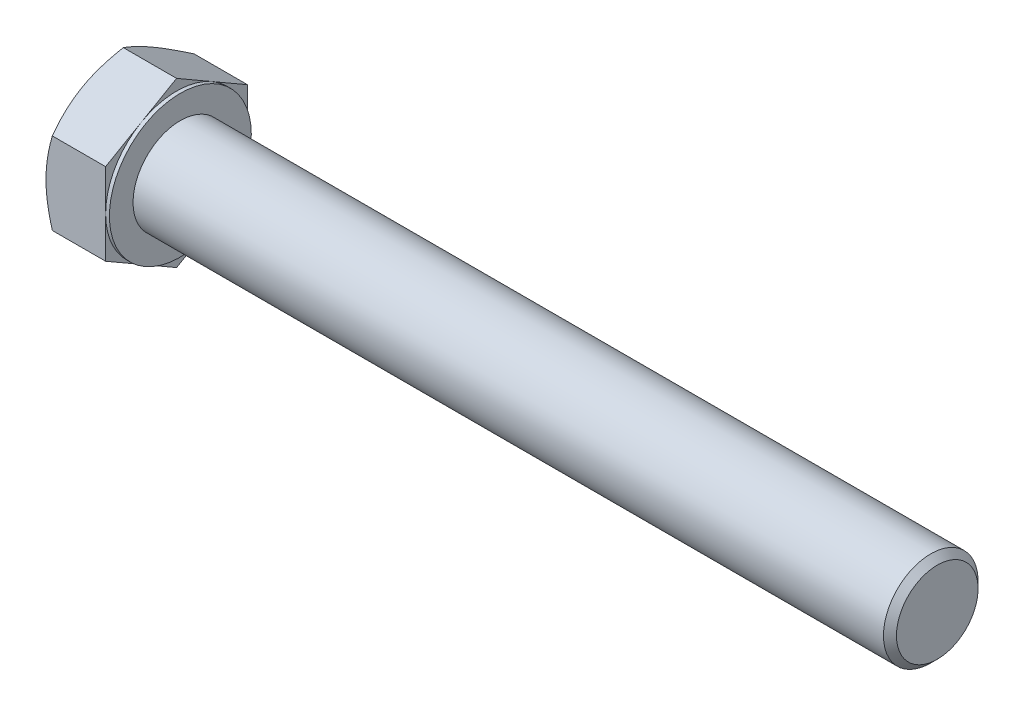
from build123d import *

# Parameters (mm, degrees)
BASEHEAD_DEPTH = 13.4
SKETCH4_W      = 0.8
SKETCH4_H      = 12.320508076


# Read off the part's stored shape, not the designer's step: HeadChamfer
with BuildPart() as part:
    # Sketch1 → BaseHead (new body)
    with BuildSketch(Plane(origin=(0, 0, 0), x_dir=(0, 0, -1), z_dir=(1, 0, 0))):
        Polygon((15, 8.660254038), (15, -8.660254038), (0, -17.320508076), (-15, -8.660254038), (-15, 8.660254038), (0, 17.320508076), align=None)
    extrude(amount=BASEHEAD_DEPTH)

    # HeadChamfer outline → HeadChamfer (revolve, cut)
    with BuildSketch(Plane.YX):
        Polygon((17.320508077, 1.339745963), (14.99999979, -1.21e-07), (17.320508077, -1.21e-07), align=None)
    revolve(axis=Axis((0, 0, 0), (1, 0, 0)), mode=Mode.SUBTRACT)

    # HeadChamfer 2 outline → HeadChamfer 2 (revolve)
    with BuildSketch(Plane.YX):
        Polygon((10, 13.4), (10, 172.026), (8.626, 173.4), (0, 173.4), (0, 13.4), align=None)
    revolve(axis=Axis((0, 0, 0), (1, 0, 0)))

    # Sketch4 → BearingFace (revolve, cut)
    with BuildSketch(Plane.XY, mode=Mode.PRIVATE) as bearingface_sk:
        with Locations((13, 21.160254038)):
            Rectangle(SKETCH4_W, SKETCH4_H)
    revolve(bearingface_sk.sketch.rotate(Axis((0, 0, 0), (1, 0, 0)), 90), axis=Axis((0, 0, 0), (1, 0, 0)), mode=Mode.SUBTRACT)


solid = part.part
